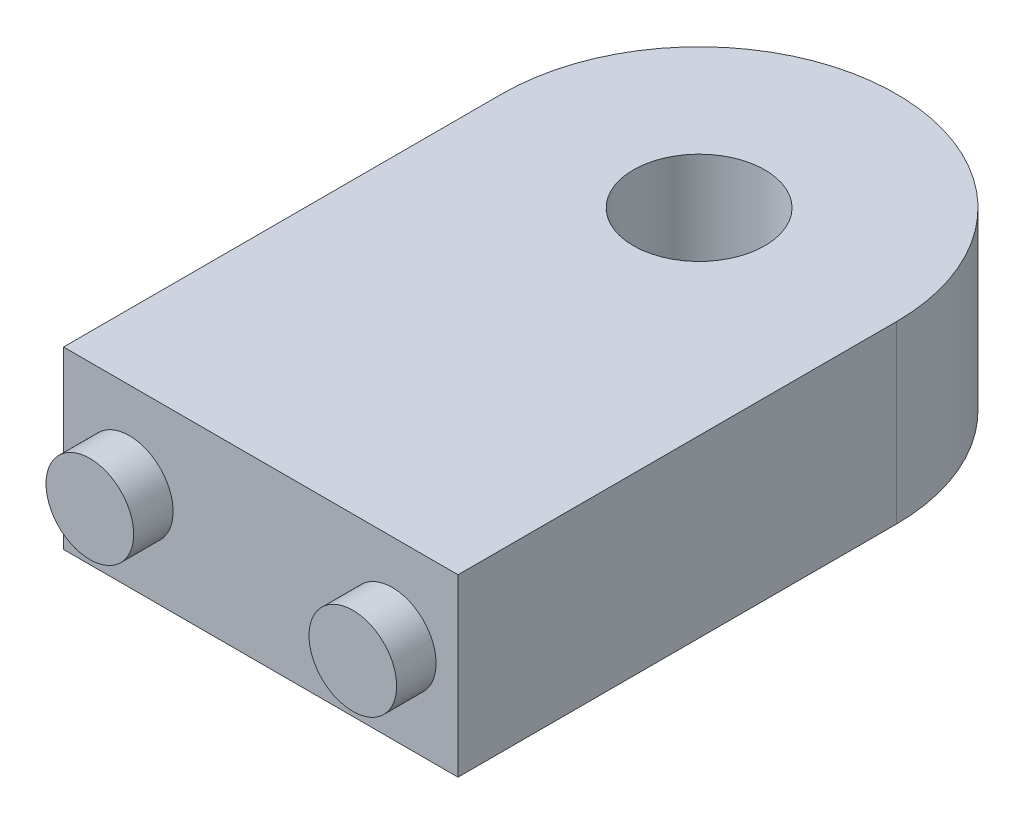
from build123d import *

# Parameters (mm, degrees)
BOSS_EXTRUDE1_DEPTH = 200
SKETCH2_R           = 75
CUT_EXTRUDE1_DEPTH  = 563.36109396
BOSS_EXTRUDE2_DEPTH = 45
SKETCH5_R           = 50
BOSS_EXTRUDE3_DEPTH = 45


with BuildPart() as part:
    # Sketch1 → Boss-Extrude1 (new body)
    with BuildSketch(Plane(origin=(0, 0, 0), x_dir=(1, 0, 0), z_dir=(0, 1, 0))):
        with BuildLine():
            Line((-225, 250), (-225, -250))
            Line((-225, -250), (225, -250))
            Line((225, -250), (225, 250))
            ThreePointArc((225, 250), (0, 475), (-225, 250))
        make_face()
    extrude(amount=BOSS_EXTRUDE1_DEPTH)

    # Sketch2 → Cut-Extrude1 (cut, through all)
    with BuildSketch(Plane(origin=(0, 200, 0), x_dir=(1, 0, 0), z_dir=(0, 1, 0))):
        with Locations((0, 250)):
            Circle(SKETCH2_R)
    extrude(amount=-CUT_EXTRUDE1_DEPTH, mode=Mode.SUBTRACT)

    # Sketch4 → Boss-Extrude2 (add)
    with BuildSketch(Plane.XY.offset(250)):
        with BuildLine():
            ThreePointArc((100, 100), (150, 50), (200, 100))
            ThreePointArc((200, 100), (150, 150), (100, 100))
        make_face()
    extrude(amount=BOSS_EXTRUDE2_DEPTH)

    # Sketch5 → Boss-Extrude3 (add)
    with BuildSketch(Plane.XY.offset(250)):
        with Locations((-150, 100)):
            Circle(SKETCH5_R)
    extrude(amount=BOSS_EXTRUDE3_DEPTH)


solid = part.part
